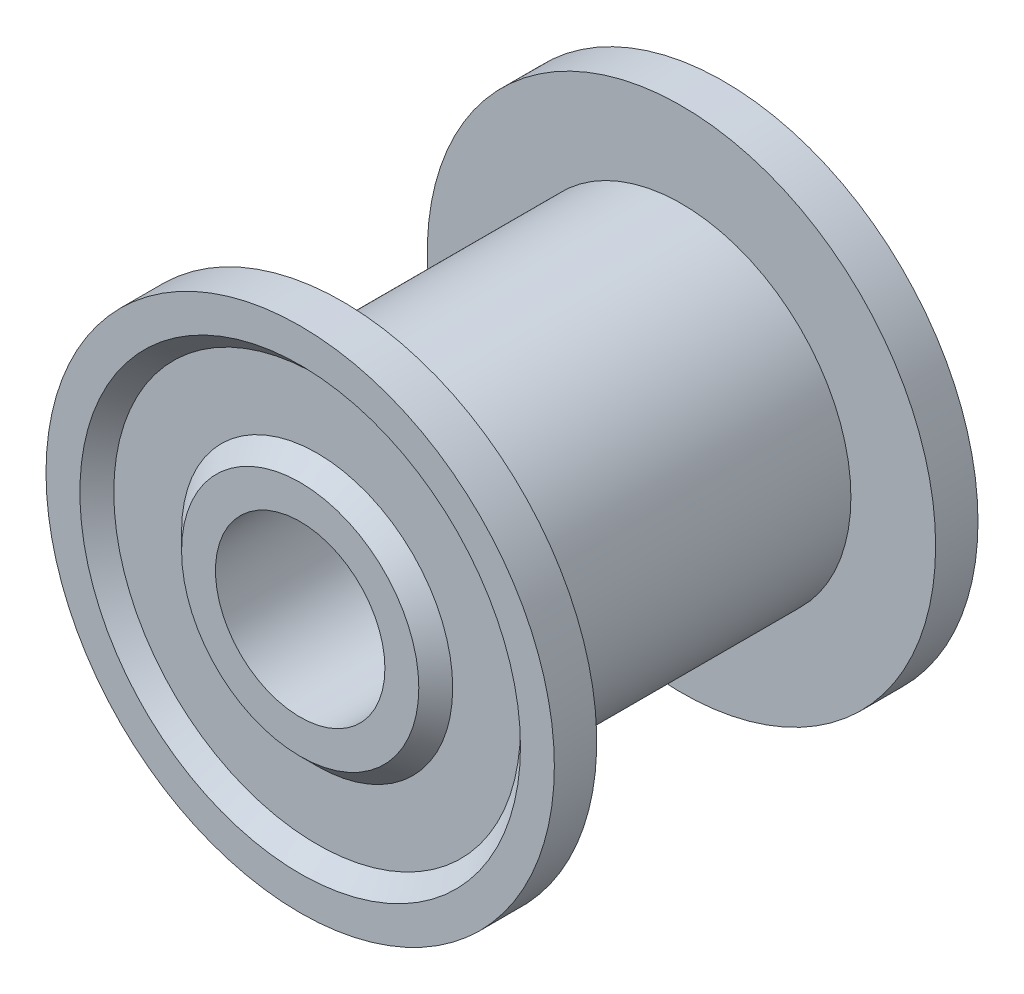
from build123d import *

# Parameters (mm, degrees)
CROQUIS1_R                 = 15
CROQUIS1_R_2               = 5
SALIENTE_EXTRUIR1_DEPTH    = 25
CROQUIS3_W                 = 20
CROQUIS3_H                 = 10
CROQUIS4_R                 = 13
CROQUIS4_R_2               = 7
CORTAR_EXTRUIR1_DEPTH      = 1
CHAFL_N1_SIZE              = 1
CHAFL_N1_OF_SIMETR_A2_SIZE = 1


with BuildPart() as part:
    # Croquis1 → Saliente-Extruir1 (new body)
    with BuildSketch(Plane.XY):
        Circle(CROQUIS1_R)
        Circle(CROQUIS1_R_2, mode=Mode.SUBTRACT)
    extrude(amount=SALIENTE_EXTRUIR1_DEPTH)

    # Croquis3 → Cortar-Revolución1 (revolve, cut)
    with BuildSketch(Plane(origin=(0, 0, 0), x_dir=(0, 0, -1), z_dir=(1, 0, 0)), mode=Mode.PRIVATE) as cortar_revoluci_n1_sk:
        with Locations((-12.5, 15)):
            Rectangle(CROQUIS3_W, CROQUIS3_H)
    revolve(cortar_revoluci_n1_sk.sketch.rotate(Axis((0, 0, 25), (0, 0, -1)), 90), axis=Axis((0, 0, 25), (0, 0, -1)), mode=Mode.SUBTRACT)

    # Croquis4 → Cortar-Extruir1 (cut)
    with BuildSketch(Plane.XY.offset(25)):
        Circle(CROQUIS4_R)
        Circle(CROQUIS4_R_2, mode=Mode.SUBTRACT)
    cortar_extruir1 = extrude(amount=-CORTAR_EXTRUIR1_DEPTH, mode=Mode.SUBTRACT)

    # Chaflán1
    chafl_n1_edges = [part.edges().sort_by_distance(p)[0] for p in [
        (-13, 0, 24),
        (-7, 0, 24),
    ]]
    chamfer(chafl_n1_edges, length=CHAFL_N1_SIZE - 0.0001)  # a hair under: the kernel refuses the full size

    # Simetría2: Cortar-Extruir1 across plane
    add(cortar_extruir1.mirror(Plane.XY.offset(12.5)), mode=Mode.SUBTRACT)

    # Chaflán1 of Simetría2
    chafl_n1_of_simetr_a2_edges = [part.edges().sort_by_distance(p)[0] for p in [
        (-13, 0, 1),
        (-7, 0, 1),
    ]]
    chamfer(chafl_n1_of_simetr_a2_edges, length=CHAFL_N1_OF_SIMETR_A2_SIZE - 0.0001)  # a hair under: the kernel refuses the full size


solid = part.part
